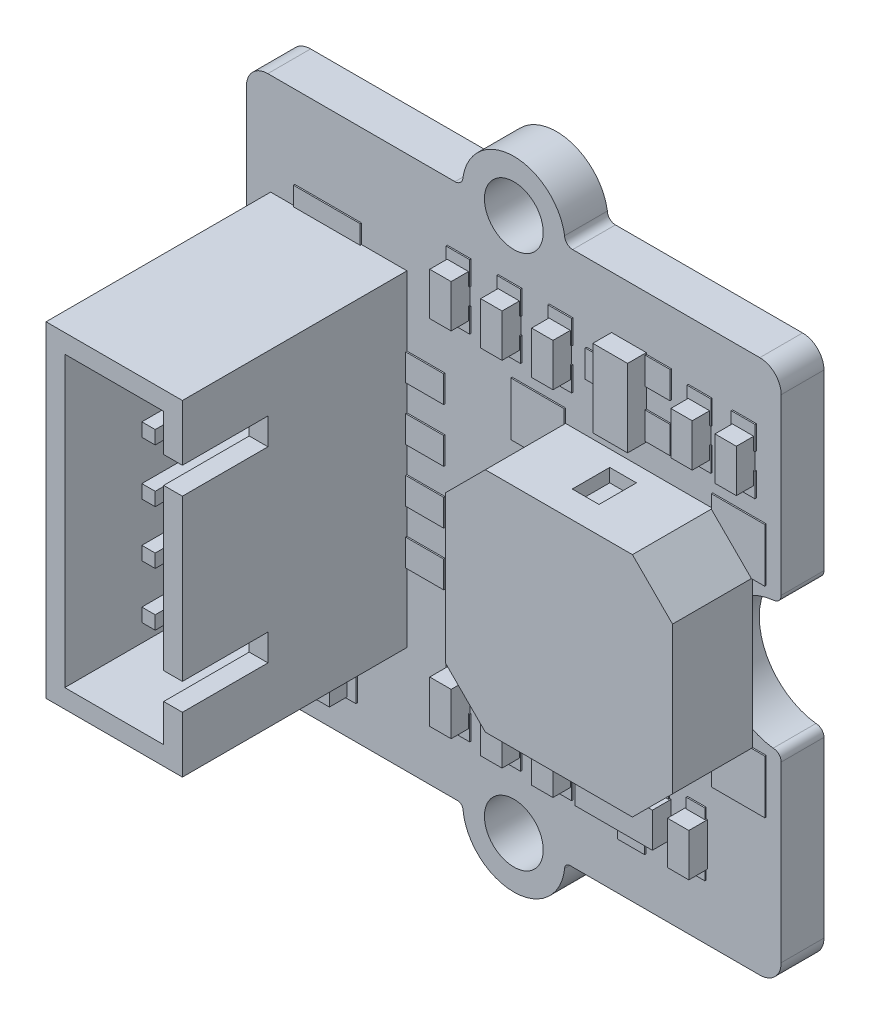
from build123d import *

# Parameters (mm, degrees)
ESQUISSE1_R                            = 1.1
PCB_CONTOUR_EAGLE_EP_ESTIMEE_1_6_DEPTH = 1.6
GROVE_POSITION_EAGLE_H_ESTIMEE_START   = 1.6
ESQUISSE2_W                            = 5.1
ESQUISSE2_H                            = 12.2
GROVE_POSITION_EAGLE_H_ESTIMEE_DEPTH   = 8.4
CAVITE_CONNECTEUR_START                = 10
ESQUISSE3_W                            = 3.7
ESQUISSE3_H                            = 10.8
CAVITE_CONNECTEUR_DEPTH                = 7.3
DETROMPEURS_ESTIMES_START              = 10
ESQUISSE4_W                            = 1
ESQUISSE4_H                            = 1
DETROMPEURS_ESTIMES_DEPTH              = 3.2
CONTACTS_GROVE_PAS_2MM_START           = 2.7
ESQUISSE5_W                            = 0.5
ESQUISSE5_H                            = 0.5
CONTACTS_GROVE_PAS_2MM_DEPTH           = 5.9
CONTACTS_GROVE_PAS_2MM_2_DEPTH         = 5.9
CONTACTS_GROVE_PAS_2MM_3_DEPTH         = 5.9
CONTACTS_GROVE_PAS_2MM_4_DEPTH         = 5.9
MLT8530_8_5X8_5X3_START                = 1.6
MLT8530_8_5X8_5X3_DEPTH                = 3
SORTIE_SON_LATERALE_ESTIMEE_START      = 3.6
ESQUISSE7_W                            = 1
ESQUISSE7_H                            = 0.8
SORTIE_SON_LATERALE_ESTIMEE_DEPTH      = 1.4
C1_POSITION_EAGLE_H_SIMPLIFIEE_START   = 1.6
ESQUISSE8_W                            = 0.8
ESQUISSE8_H                            = 1.6
C1_POSITION_EAGLE_H_SIMPLIFIEE_DEPTH   = 0.7
C2_POSITION_EAGLE_H_SIMPLIFIEE_START   = 1.6
ESQUISSE9_W                            = 0.8
ESQUISSE9_H                            = 1.6
C2_POSITION_EAGLE_H_SIMPLIFIEE_DEPTH   = 0.7
Q1_POSITION_EAGLE_H_SIMPLIFIEE_START   = 1.6
ESQUISSE10_W                           = 2.9
ESQUISSE10_H                           = 1.3
Q1_POSITION_EAGLE_H_SIMPLIFIEE_DEPTH   = 0.7
R1_POSITION_EAGLE_H_SIMPLIFIEE_START   = 1.6
ESQUISSE11_W                           = 0.8
ESQUISSE11_H                           = 1.6
R1_POSITION_EAGLE_H_SIMPLIFIEE_DEPTH   = 0.7
U1_POSITION_EAGLE_H_SIMPLIFIEE_START   = 1.6
ESQUISSE12_W                           = 1.3
ESQUISSE12_H                           = 2.9
U1_POSITION_EAGLE_H_SIMPLIFIEE_DEPTH   = 0.7
C3_POSITION_EAGLE_H_SIMPLIFIEE_START   = 1.6
ESQUISSE13_W                           = 0.8
ESQUISSE13_H                           = 1.6
C3_POSITION_EAGLE_H_SIMPLIFIEE_DEPTH   = 0.7
C5_POSITION_EAGLE_H_SIMPLIFIEE_START   = 1.6
ESQUISSE14_W                           = 0.8
ESQUISSE14_H                           = 1.6
C5_POSITION_EAGLE_H_SIMPLIFIEE_DEPTH   = 0.7
C4_POSITION_EAGLE_H_SIMPLIFIEE_START   = 1.6
ESQUISSE15_W                           = 0.8
ESQUISSE15_H                           = 1.6
C4_POSITION_EAGLE_H_SIMPLIFIEE_DEPTH   = 0.7
R2_POSITION_EAGLE_H_SIMPLIFIEE_START   = 1.6
ESQUISSE16_W                           = 0.8
ESQUISSE16_H                           = 1.6
R2_POSITION_EAGLE_H_SIMPLIFIEE_DEPTH   = 0.7
D1_POSITION_EAGLE_H_SIMPLIFIEE_START   = 1.6
ESQUISSE17_W                           = 1.6
ESQUISSE17_H                           = 0.8
D1_POSITION_EAGLE_H_SIMPLIFIEE_DEPTH   = 0.7
D2_POSITION_EAGLE_H_SIMPLIFIEE_START   = 1.6
ESQUISSE18_W                           = 0.8
ESQUISSE18_H                           = 1.6
D2_POSITION_EAGLE_H_SIMPLIFIEE_DEPTH   = 0.7
R3_POSITION_EAGLE_H_SIMPLIFIEE_START   = 1.6
ESQUISSE19_W                           = 0.8
ESQUISSE19_H                           = 1.6
R3_POSITION_EAGLE_H_SIMPLIFIEE_DEPTH   = 0.7
PAD_C1_0_START                         = 1.6
ESQUISSE20_W                           = 0.889
ESQUISSE20_H                           = 0.889
PAD_C1_0_DEPTH                         = 0.05
PAD_C1_1_START                         = 1.6
ESQUISSE21_W                           = 0.889
ESQUISSE21_H                           = 0.889
PAD_C1_1_DEPTH                         = 0.05
PAD_C2_0_START                         = 1.6
ESQUISSE22_W                           = 0.889
ESQUISSE22_H                           = 0.889
PAD_C2_0_DEPTH                         = 0.05
PAD_C2_1_START                         = 1.6
ESQUISSE23_W                           = 0.889
ESQUISSE23_H                           = 0.889
PAD_C2_1_DEPTH                         = 0.05
PAD_J1_0_START                         = 1.6
ESQUISSE24_W                           = 2.5
ESQUISSE24_H                           = 1
PAD_J1_0_DEPTH                         = 0.05
PAD_J1_1_START                         = 1.6
ESQUISSE25_W                           = 2.5
ESQUISSE25_H                           = 1
PAD_J1_1_DEPTH                         = 0.05
PAD_J1_2_START                         = 1.6
ESQUISSE26_W                           = 2.5
ESQUISSE26_H                           = 1
PAD_J1_2_DEPTH                         = 0.05
PAD_J1_3_START                         = 1.6
ESQUISSE27_W                           = 2.5
ESQUISSE27_H                           = 1
PAD_J1_3_DEPTH                         = 0.05
PAD_J1_4_START                         = 1.6
ESQUISSE28_W                           = 2.5
ESQUISSE28_H                           = 2
PAD_J1_4_DEPTH                         = 0.05
PAD_J1_5_START                         = 1.6
ESQUISSE29_W                           = 2.5
ESQUISSE29_H                           = 2
PAD_J1_5_DEPTH                         = 0.05
PAD_Q1_0_START                         = 1.6
ESQUISSE30_W                           = 1.016
ESQUISSE30_H                           = 1.143
PAD_Q1_0_DEPTH                         = 0.05
PAD_Q1_1_START                         = 1.6
ESQUISSE31_W                           = 1.016
ESQUISSE31_H                           = 1.143
PAD_Q1_1_DEPTH                         = 0.05
PAD_Q1_2_START                         = 1.6
ESQUISSE32_W                           = 1.016
ESQUISSE32_H                           = 1.143
PAD_Q1_2_DEPTH                         = 0.05
PAD_R1_0_START                         = 1.6
ESQUISSE33_W                           = 0.889
ESQUISSE33_H                           = 0.889
PAD_R1_0_DEPTH                         = 0.05
PAD_R1_1_START                         = 1.6
ESQUISSE34_W                           = 0.889
ESQUISSE34_H                           = 0.889
PAD_R1_1_DEPTH                         = 0.05
PAD_BUZ1_0_START                       = 1.6
ESQUISSE35_W                           = 2
ESQUISSE35_H                           = 2
PAD_BUZ1_0_DEPTH                       = 0.05
PAD_BUZ1_1_START                       = 1.6
ESQUISSE36_W                           = 2
ESQUISSE36_H                           = 2
PAD_BUZ1_1_DEPTH                       = 0.05
PAD_BUZ1_2_START                       = 1.6
ESQUISSE37_W                           = 2
ESQUISSE37_H                           = 2
PAD_BUZ1_2_DEPTH                       = 0.05
PAD_BUZ1_3_START                       = 1.6
ESQUISSE38_W                           = 2
ESQUISSE38_H                           = 2
PAD_BUZ1_3_DEPTH                       = 0.05
PAD_U1_0_START                         = 1.6
ESQUISSE39_W                           = 1.143
ESQUISSE39_H                           = 1.016
PAD_U1_0_DEPTH                         = 0.05
PAD_U1_1_START                         = 1.6
ESQUISSE40_W                           = 1.143
ESQUISSE40_H                           = 1.016
PAD_U1_1_DEPTH                         = 0.05
PAD_U1_2_START                         = 1.6
ESQUISSE41_W                           = 1.143
ESQUISSE41_H                           = 1.016
PAD_U1_2_DEPTH                         = 0.05
PAD_C3_0_START                         = 1.6
ESQUISSE42_W                           = 0.889
ESQUISSE42_H                           = 0.889
PAD_C3_0_DEPTH                         = 0.05
PAD_C3_1_START                         = 1.6
ESQUISSE43_W                           = 0.889
ESQUISSE43_H                           = 0.889
PAD_C3_1_DEPTH                         = 0.05
PAD_C5_0_START                         = 1.6
ESQUISSE44_W                           = 0.889
ESQUISSE44_H                           = 0.889
PAD_C5_0_DEPTH                         = 0.05
PAD_C5_1_START                         = 1.6
ESQUISSE45_W                           = 0.889
ESQUISSE45_H                           = 0.889
PAD_C5_1_DEPTH                         = 0.05
PAD_C4_0_START                         = 1.6
ESQUISSE46_W                           = 0.889
ESQUISSE46_H                           = 0.889
PAD_C4_0_DEPTH                         = 0.05
PAD_C4_1_START                         = 1.6
ESQUISSE47_W                           = 0.889
ESQUISSE47_H                           = 0.889
PAD_C4_1_DEPTH                         = 0.05
PAD_R2_0_START                         = 1.6
ESQUISSE48_W                           = 0.889
ESQUISSE48_H                           = 0.889
PAD_R2_0_DEPTH                         = 0.05
PAD_R2_1_START                         = 1.6
ESQUISSE49_W                           = 0.889
ESQUISSE49_H                           = 0.889
PAD_R2_1_DEPTH                         = 0.05
PAD_D1_0_START                         = 1.6
ESQUISSE50_W                           = 0.762
ESQUISSE50_H                           = 0.889
PAD_D1_0_DEPTH                         = 0.05
PAD_D1_1_START                         = 1.6
ESQUISSE51_W                           = 0.762
ESQUISSE51_H                           = 0.889
PAD_D1_1_DEPTH                         = 0.05
PAD_D2_0_START                         = 1.6
ESQUISSE52_W                           = 0.7
ESQUISSE52_H                           = 0.762
PAD_D2_0_DEPTH                         = 0.05
PAD_D2_1_START                         = 1.6
ESQUISSE53_W                           = 0.7
ESQUISSE53_H                           = 0.762
PAD_D2_1_DEPTH                         = 0.05
PAD_R3_0_START                         = 1.6
ESQUISSE54_W                           = 0.889
ESQUISSE54_H                           = 0.889
PAD_R3_0_DEPTH                         = 0.05
PAD_R3_1_START                         = 1.6
ESQUISSE55_W                           = 0.889
ESQUISSE55_H                           = 0.889
PAD_R3_1_DEPTH                         = 0.05


with BuildPart() as part:
    # Esquisse1 → PCB_contour_Eagle_ep_ESTIMEE_1_6 (new body)
    with BuildSketch(Plane.XY):
        with BuildLine():
            Line((-9.1873, -9.9873), (-2.0873, -9.9873))
            ThreePointArc((-2.0873, -9.9873), (-1.945878644, -10.045878644), (-1.8873, -10.1873))
            ThreePointArc((-1.8873, -10.1873), (0.0127, -11.897797316), (1.9127, -10.1873))
            ThreePointArc((1.9127, -10.1873), (1.971278644, -10.045878644), (2.1127, -9.9873))
            Line((2.1127, -9.9873), (9.2127, -9.9873))
            ThreePointArc((9.2127, -9.9873), (9.778385425, -9.752985425), (10.0127, -9.1873))
            Line((10.0127, -9.1873), (10.0127, -2.6873))
            ThreePointArc((10.0127, -2.6873), (9.924832034, -2.475167966), (9.7127, -2.3873))
            ThreePointArc((9.7127, -2.3873), (7.594022681, 0.0127), (9.7127, 2.4127))
            ThreePointArc((9.7127, 2.4127), (9.924832034, 2.500567966), (10.0127, 2.7127))
            Line((10.0127, 2.7127), (10.0127, 9.2127))
            ThreePointArc((10.0127, 9.2127), (9.778385425, 9.778385425), (9.2127, 10.0127))
            Line((9.2127, 10.0127), (2.2127, 10.0127))
            ThreePointArc((2.2127, 10.0127), (2.000567966, 10.100567966), (1.9127, 10.3127))
            ThreePointArc((1.9127, 10.3127), (0.0127, 11.936238409), (-1.8873, 10.3127))
            ThreePointArc((-1.8873, 10.3127), (-1.975167966, 10.100567966), (-2.1873, 10.0127))
            Line((-2.1873, 10.0127), (-9.1873, 10.0127))
            ThreePointArc((-9.1873, 10.0127), (-9.752985425, 9.778385425), (-9.9873, 9.2127))
            Line((-9.9873, 9.2127), (-9.9873, 2.7127))
            ThreePointArc((-9.9873, 2.7127), (-9.899432034, 2.500567966), (-9.6873, 2.4127))
            ThreePointArc((-9.6873, 2.4127), (-7.568622681, 0.0127), (-9.6873, -2.3873))
            ThreePointArc((-9.6873, -2.3873), (-9.899432034, -2.475167966), (-9.9873, -2.6873))
            Line((-9.9873, -2.6873), (-9.9873, -9.1873))
            ThreePointArc((-9.9873, -9.1873), (-9.752985425, -9.752985425), (-9.1873, -9.9873))
        make_face()
        with Locations((0.0127, -9.987299999)):
            Circle(ESQUISSE1_R, mode=Mode.SUBTRACT)
        with Locations((0.0127, 10.012700004)):
            Circle(ESQUISSE1_R, mode=Mode.SUBTRACT)
    extrude(amount=PCB_CONTOUR_EAGLE_EP_ESTIMEE_1_6_DEPTH)


with BuildPart() as body_2:
    # Esquisse2 → Grove_position_Eagle_H_ESTIMEE (new body)
    with BuildSketch(Plane.XY.offset(GROVE_POSITION_EAGLE_H_ESTIMEE_START)):
        with Locations((-6.533, 0.127)):
            Rectangle(ESQUISSE2_W, ESQUISSE2_H)
    extrude(amount=GROVE_POSITION_EAGLE_H_ESTIMEE_DEPTH)

    # Esquisse3 → Cavite_connecteur (cut)
    with BuildSketch(Plane.XY.offset(CAVITE_CONNECTEUR_START)):
        with Locations((-6.533, 0.127)):
            Rectangle(ESQUISSE3_W, ESQUISSE3_H)
    extrude(amount=-CAVITE_CONNECTEUR_DEPTH, mode=Mode.SUBTRACT)

    # Esquisse4 → Detrompeurs_ESTIMES (cut)
    with BuildSketch(Plane.XY.offset(DETROMPEURS_ESTIMES_START)):
        with Locations((-4.283, -3.373)):
            Rectangle(ESQUISSE4_W, ESQUISSE4_H)
        with Locations((-4.283, 3.627)):
            Rectangle(ESQUISSE4_W, ESQUISSE4_H)
    extrude(amount=-DETROMPEURS_ESTIMES_DEPTH, mode=Mode.SUBTRACT)


with BuildPart() as body_3:
    # Esquisse5 → Contacts_Grove_pas_2mm (new body)
    with BuildSketch(Plane.XY.offset(CONTACTS_GROVE_PAS_2MM_START)):
        with Locations((-6.65, -2.873)):
            Rectangle(ESQUISSE5_W, ESQUISSE5_H)
    extrude(amount=CONTACTS_GROVE_PAS_2MM_DEPTH)


with BuildPart() as body_4:
    # Esquisse5 → Contacts_Grove_pas_2mm 2 (new body)
    with BuildSketch(Plane.XY.offset(CONTACTS_GROVE_PAS_2MM_START)):
        with Locations((-6.65, -0.873)):
            Rectangle(ESQUISSE5_W, ESQUISSE5_H)
    extrude(amount=CONTACTS_GROVE_PAS_2MM_2_DEPTH)


with BuildPart() as body_5:
    # Esquisse5 → Contacts_Grove_pas_2mm 3 (new body)
    with BuildSketch(Plane.XY.offset(CONTACTS_GROVE_PAS_2MM_START)):
        with Locations((-6.65, 1.127)):
            Rectangle(ESQUISSE5_W, ESQUISSE5_H)
    extrude(amount=CONTACTS_GROVE_PAS_2MM_3_DEPTH)


with BuildPart() as body_6:
    # Esquisse5 → Contacts_Grove_pas_2mm 4 (new body)
    with BuildSketch(Plane.XY.offset(CONTACTS_GROVE_PAS_2MM_START)):
        with Locations((-6.65, 3.127)):
            Rectangle(ESQUISSE5_W, ESQUISSE5_H)
    extrude(amount=CONTACTS_GROVE_PAS_2MM_4_DEPTH)


with BuildPart() as body_7:
    # Esquisse6 → MLT8530_8_5x8_5x3 (new body)
    with BuildSketch(Plane.XY.offset(MLT8530_8_5X8_5X3_START)):
        Polygon((1.949, -4.25), (7.449, -4.25), (8.949, -2.75), (8.949, 2.75), (7.449, 4.25), (1.949, 4.25), (0.449, 2.75), (0.449, -2.75), align=None)
    extrude(amount=MLT8530_8_5X8_5X3_DEPTH)

    # Esquisse7 → Sortie_son_laterale_ESTIMEE (cut)
    with BuildSketch(Plane.XY.offset(SORTIE_SON_LATERALE_ESTIMEE_START)):
        with Locations((4.699, 4.15)):
            Rectangle(ESQUISSE7_W, ESQUISSE7_H)
    extrude(amount=-SORTIE_SON_LATERALE_ESTIMEE_DEPTH, mode=Mode.SUBTRACT)


with BuildPart() as body_8:
    # Esquisse8 → C1_position_Eagle_H_simplifiee (new body)
    with BuildSketch(Plane.XY.offset(C1_POSITION_EAGLE_H_SIMPLIFIEE_START)):
        with Locations((-0.127, 6.604)):
            Rectangle(ESQUISSE8_W, ESQUISSE8_H)
    extrude(amount=C1_POSITION_EAGLE_H_SIMPLIFIEE_DEPTH)


with BuildPart() as body_9:
    # Esquisse9 → C2_position_Eagle_H_simplifiee (new body)
    with BuildSketch(Plane.XY.offset(C2_POSITION_EAGLE_H_SIMPLIFIEE_START)):
        with Locations((-2.032, 6.604)):
            Rectangle(ESQUISSE9_W, ESQUISSE9_H)
    extrude(amount=C2_POSITION_EAGLE_H_SIMPLIFIEE_DEPTH)


with BuildPart() as body_10:
    # Esquisse10 → Q1_position_Eagle_H_simplifiee (new body)
    with BuildSketch(Plane.XY.offset(Q1_POSITION_EAGLE_H_SIMPLIFIEE_START)):
        with Locations((4.445, -6.604)):
            Rectangle(ESQUISSE10_W, ESQUISSE10_H)
    extrude(amount=Q1_POSITION_EAGLE_H_SIMPLIFIEE_DEPTH)


with BuildPart() as body_11:
    # Esquisse11 → R1_position_Eagle_H_simplifiee (new body)
    with BuildSketch(Plane.XY.offset(R1_POSITION_EAGLE_H_SIMPLIFIEE_START)):
        with Locations((-0.127, -6.604)):
            Rectangle(ESQUISSE11_W, ESQUISSE11_H)
    extrude(amount=R1_POSITION_EAGLE_H_SIMPLIFIEE_DEPTH)


with BuildPart() as body_12:
    # Esquisse12 → U1_position_Eagle_H_simplifiee (new body)
    with BuildSketch(Plane.XY.offset(U1_POSITION_EAGLE_H_SIMPLIFIEE_START)):
        with Locations((4.318, 6.604)):
            Rectangle(ESQUISSE12_W, ESQUISSE12_H)
    extrude(amount=U1_POSITION_EAGLE_H_SIMPLIFIEE_DEPTH)


with BuildPart() as body_13:
    # Esquisse13 → C3_position_Eagle_H_simplifiee (new body)
    with BuildSketch(Plane.XY.offset(C3_POSITION_EAGLE_H_SIMPLIFIEE_START)):
        with Locations((1.778, 6.604)):
            Rectangle(ESQUISSE13_W, ESQUISSE13_H)
    extrude(amount=C3_POSITION_EAGLE_H_SIMPLIFIEE_DEPTH)


with BuildPart() as body_14:
    # Esquisse14 → C5_position_Eagle_H_simplifiee (new body)
    with BuildSketch(Plane.XY.offset(C5_POSITION_EAGLE_H_SIMPLIFIEE_START)):
        with Locations((8.636, 6.604)):
            Rectangle(ESQUISSE14_W, ESQUISSE14_H)
    extrude(amount=C5_POSITION_EAGLE_H_SIMPLIFIEE_DEPTH)


with BuildPart() as body_15:
    # Esquisse15 → C4_position_Eagle_H_simplifiee (new body)
    with BuildSketch(Plane.XY.offset(C4_POSITION_EAGLE_H_SIMPLIFIEE_START)):
        with Locations((6.985, 6.604)):
            Rectangle(ESQUISSE15_W, ESQUISSE15_H)
    extrude(amount=C4_POSITION_EAGLE_H_SIMPLIFIEE_DEPTH)


with BuildPart() as body_16:
    # Esquisse16 → R2_position_Eagle_H_simplifiee (new body)
    with BuildSketch(Plane.XY.offset(R2_POSITION_EAGLE_H_SIMPLIFIEE_START)):
        with Locations((-2.032, -6.604)):
            Rectangle(ESQUISSE16_W, ESQUISSE16_H)
    extrude(amount=R2_POSITION_EAGLE_H_SIMPLIFIEE_DEPTH)


with BuildPart() as body_17:
    # Esquisse17 → D1_position_Eagle_H_simplifiee (new body)
    with BuildSketch(Plane.XY.offset(D1_POSITION_EAGLE_H_SIMPLIFIEE_START)):
        with Locations((-6.985, -8.255)):
            Rectangle(ESQUISSE17_W, ESQUISSE17_H)
    extrude(amount=D1_POSITION_EAGLE_H_SIMPLIFIEE_DEPTH)


with BuildPart() as body_18:
    # Esquisse18 → D2_position_Eagle_H_simplifiee (new body)
    with BuildSketch(Plane.XY.offset(D2_POSITION_EAGLE_H_SIMPLIFIEE_START)):
        with Locations((6.858, -6.731)):
            Rectangle(ESQUISSE18_W, ESQUISSE18_H)
    extrude(amount=D2_POSITION_EAGLE_H_SIMPLIFIEE_DEPTH)


with BuildPart() as body_19:
    # Esquisse19 → R3_position_Eagle_H_simplifiee (new body)
    with BuildSketch(Plane.XY.offset(R3_POSITION_EAGLE_H_SIMPLIFIEE_START)):
        with Locations((1.778, -6.604)):
            Rectangle(ESQUISSE19_W, ESQUISSE19_H)
    extrude(amount=R3_POSITION_EAGLE_H_SIMPLIFIEE_DEPTH)


with BuildPart() as body_20:
    # Esquisse20 → Pad_C1_0 (new body)
    with BuildSketch(Plane.XY.offset(PAD_C1_0_START)):
        with Locations((-0.127, 7.366)):
            Rectangle(ESQUISSE20_W, ESQUISSE20_H)
    extrude(amount=PAD_C1_0_DEPTH)


with BuildPart() as body_21:
    # Esquisse21 → Pad_C1_1 (new body)
    with BuildSketch(Plane.XY.offset(PAD_C1_1_START)):
        with Locations((-0.127, 5.842)):
            Rectangle(ESQUISSE21_W, ESQUISSE21_H)
    extrude(amount=PAD_C1_1_DEPTH)


with BuildPart() as body_22:
    # Esquisse22 → Pad_C2_0 (new body)
    with BuildSketch(Plane.XY.offset(PAD_C2_0_START)):
        with Locations((-2.032, 7.366)):
            Rectangle(ESQUISSE22_W, ESQUISSE22_H)
    extrude(amount=PAD_C2_0_DEPTH)


with BuildPart() as body_23:
    # Esquisse23 → Pad_C2_1 (new body)
    with BuildSketch(Plane.XY.offset(PAD_C2_1_START)):
        with Locations((-2.032, 5.842)):
            Rectangle(ESQUISSE23_W, ESQUISSE23_H)
    extrude(amount=PAD_C2_1_DEPTH)


with BuildPart() as body_24:
    # Esquisse24 → Pad_J1_0 (new body)
    with BuildSketch(Plane.XY.offset(PAD_J1_0_START)):
        with Locations((-3.81, -2.873)):
            Rectangle(ESQUISSE24_W, ESQUISSE24_H)
    extrude(amount=PAD_J1_0_DEPTH)


with BuildPart() as body_25:
    # Esquisse25 → Pad_J1_1 (new body)
    with BuildSketch(Plane.XY.offset(PAD_J1_1_START)):
        with Locations((-3.81, -0.873)):
            Rectangle(ESQUISSE25_W, ESQUISSE25_H)
    extrude(amount=PAD_J1_1_DEPTH)


with BuildPart() as body_26:
    # Esquisse26 → Pad_J1_2 (new body)
    with BuildSketch(Plane.XY.offset(PAD_J1_2_START)):
        with Locations((-3.81, 1.127)):
            Rectangle(ESQUISSE26_W, ESQUISSE26_H)
    extrude(amount=PAD_J1_2_DEPTH)


with BuildPart() as body_27:
    # Esquisse27 → Pad_J1_3 (new body)
    with BuildSketch(Plane.XY.offset(PAD_J1_3_START)):
        with Locations((-3.81, 3.127)):
            Rectangle(ESQUISSE27_W, ESQUISSE27_H)
    extrude(amount=PAD_J1_3_DEPTH)


with BuildPart() as body_28:
    # Esquisse28 → Pad_J1_4 (new body)
    with BuildSketch(Plane.XY.offset(PAD_J1_4_START)):
        with Locations((-6.933, -5.673)):
            Rectangle(ESQUISSE28_W, ESQUISSE28_H)
    extrude(amount=PAD_J1_4_DEPTH)


with BuildPart() as body_29:
    # Esquisse29 → Pad_J1_5 (new body)
    with BuildSketch(Plane.XY.offset(PAD_J1_5_START)):
        with Locations((-6.933, 5.927)):
            Rectangle(ESQUISSE29_W, ESQUISSE29_H)
    extrude(amount=PAD_J1_5_DEPTH)


with BuildPart() as body_30:
    # Esquisse30 → Pad_Q1_0 (new body)
    with BuildSketch(Plane.XY.offset(PAD_Q1_0_START)):
        with Locations((4.445, -7.62)):
            Rectangle(ESQUISSE30_W, ESQUISSE30_H)
    extrude(amount=PAD_Q1_0_DEPTH)


with BuildPart() as body_31:
    # Esquisse31 → Pad_Q1_1 (new body)
    with BuildSketch(Plane.XY.offset(PAD_Q1_1_START)):
        with Locations((3.556, -5.588)):
            Rectangle(ESQUISSE31_W, ESQUISSE31_H)
    extrude(amount=PAD_Q1_1_DEPTH)


with BuildPart() as body_32:
    # Esquisse32 → Pad_Q1_2 (new body)
    with BuildSketch(Plane.XY.offset(PAD_Q1_2_START)):
        with Locations((5.334, -5.588)):
            Rectangle(ESQUISSE32_W, ESQUISSE32_H)
    extrude(amount=PAD_Q1_2_DEPTH)


with BuildPart() as body_33:
    # Esquisse33 → Pad_R1_0 (new body)
    with BuildSketch(Plane.XY.offset(PAD_R1_0_START)):
        with Locations((-0.127, -7.366)):
            Rectangle(ESQUISSE33_W, ESQUISSE33_H)
    extrude(amount=PAD_R1_0_DEPTH)


with BuildPart() as body_34:
    # Esquisse34 → Pad_R1_1 (new body)
    with BuildSketch(Plane.XY.offset(PAD_R1_1_START)):
        with Locations((-0.127, -5.842)):
            Rectangle(ESQUISSE34_W, ESQUISSE34_H)
    extrude(amount=PAD_R1_1_DEPTH)


with BuildPart() as body_35:
    # Esquisse35 → Pad_BUZ1_0 (new body)
    with BuildSketch(Plane.XY.offset(PAD_BUZ1_0_START)):
        with Locations((0.949, -3.75)):
            Rectangle(ESQUISSE35_W, ESQUISSE35_H)
    extrude(amount=PAD_BUZ1_0_DEPTH)


with BuildPart() as body_36:
    # Esquisse36 → Pad_BUZ1_1 (new body)
    with BuildSketch(Plane.XY.offset(PAD_BUZ1_1_START)):
        with Locations((8.449, -3.75)):
            Rectangle(ESQUISSE36_W, ESQUISSE36_H)
    extrude(amount=PAD_BUZ1_1_DEPTH)


with BuildPart() as body_37:
    # Esquisse37 → Pad_BUZ1_2 (new body)
    with BuildSketch(Plane.XY.offset(PAD_BUZ1_2_START)):
        with Locations((8.449, 3.75)):
            Rectangle(ESQUISSE37_W, ESQUISSE37_H)
    extrude(amount=PAD_BUZ1_2_DEPTH)


with BuildPart() as body_38:
    # Esquisse38 → Pad_BUZ1_3 (new body)
    with BuildSketch(Plane.XY.offset(PAD_BUZ1_3_START)):
        with Locations((0.949, 3.75)):
            Rectangle(ESQUISSE38_W, ESQUISSE38_H)
    extrude(amount=PAD_BUZ1_3_DEPTH)


with BuildPart() as body_39:
    # Esquisse39 → Pad_U1_0 (new body)
    with BuildSketch(Plane.XY.offset(PAD_U1_0_START)):
        with Locations((3.302, 6.604)):
            Rectangle(ESQUISSE39_W, ESQUISSE39_H)
    extrude(amount=PAD_U1_0_DEPTH)


with BuildPart() as body_40:
    # Esquisse40 → Pad_U1_1 (new body)
    with BuildSketch(Plane.XY.offset(PAD_U1_1_START)):
        with Locations((5.334, 7.493)):
            Rectangle(ESQUISSE40_W, ESQUISSE40_H)
    extrude(amount=PAD_U1_1_DEPTH)


with BuildPart() as body_41:
    # Esquisse41 → Pad_U1_2 (new body)
    with BuildSketch(Plane.XY.offset(PAD_U1_2_START)):
        with Locations((5.334, 5.715)):
            Rectangle(ESQUISSE41_W, ESQUISSE41_H)
    extrude(amount=PAD_U1_2_DEPTH)


with BuildPart() as body_42:
    # Esquisse42 → Pad_C3_0 (new body)
    with BuildSketch(Plane.XY.offset(PAD_C3_0_START)):
        with Locations((1.778, 7.366)):
            Rectangle(ESQUISSE42_W, ESQUISSE42_H)
    extrude(amount=PAD_C3_0_DEPTH)


with BuildPart() as body_43:
    # Esquisse43 → Pad_C3_1 (new body)
    with BuildSketch(Plane.XY.offset(PAD_C3_1_START)):
        with Locations((1.778, 5.842)):
            Rectangle(ESQUISSE43_W, ESQUISSE43_H)
    extrude(amount=PAD_C3_1_DEPTH)


with BuildPart() as body_44:
    # Esquisse44 → Pad_C5_0 (new body)
    with BuildSketch(Plane.XY.offset(PAD_C5_0_START)):
        with Locations((8.636, 5.842)):
            Rectangle(ESQUISSE44_W, ESQUISSE44_H)
    extrude(amount=PAD_C5_0_DEPTH)


with BuildPart() as body_45:
    # Esquisse45 → Pad_C5_1 (new body)
    with BuildSketch(Plane.XY.offset(PAD_C5_1_START)):
        with Locations((8.636, 7.366)):
            Rectangle(ESQUISSE45_W, ESQUISSE45_H)
    extrude(amount=PAD_C5_1_DEPTH)


with BuildPart() as body_46:
    # Esquisse46 → Pad_C4_0 (new body)
    with BuildSketch(Plane.XY.offset(PAD_C4_0_START)):
        with Locations((6.985, 5.842)):
            Rectangle(ESQUISSE46_W, ESQUISSE46_H)
    extrude(amount=PAD_C4_0_DEPTH)


with BuildPart() as body_47:
    # Esquisse47 → Pad_C4_1 (new body)
    with BuildSketch(Plane.XY.offset(PAD_C4_1_START)):
        with Locations((6.985, 7.366)):
            Rectangle(ESQUISSE47_W, ESQUISSE47_H)
    extrude(amount=PAD_C4_1_DEPTH)


with BuildPart() as body_48:
    # Esquisse48 → Pad_R2_0 (new body)
    with BuildSketch(Plane.XY.offset(PAD_R2_0_START)):
        with Locations((-2.032, -7.366)):
            Rectangle(ESQUISSE48_W, ESQUISSE48_H)
    extrude(amount=PAD_R2_0_DEPTH)


with BuildPart() as body_49:
    # Esquisse49 → Pad_R2_1 (new body)
    with BuildSketch(Plane.XY.offset(PAD_R2_1_START)):
        with Locations((-2.032, -5.842)):
            Rectangle(ESQUISSE49_W, ESQUISSE49_H)
    extrude(amount=PAD_R2_1_DEPTH)


with BuildPart() as body_50:
    # Esquisse50 → Pad_D1_0 (new body)
    with BuildSketch(Plane.XY.offset(PAD_D1_0_START)):
        with Locations((-6.223, -8.255)):
            Rectangle(ESQUISSE50_W, ESQUISSE50_H)
    extrude(amount=PAD_D1_0_DEPTH)


with BuildPart() as body_51:
    # Esquisse51 → Pad_D1_1 (new body)
    with BuildSketch(Plane.XY.offset(PAD_D1_1_START)):
        with Locations((-7.747, -8.255)):
            Rectangle(ESQUISSE51_W, ESQUISSE51_H)
    extrude(amount=PAD_D1_1_DEPTH)


with BuildPart() as body_52:
    # Esquisse52 → Pad_D2_0 (new body)
    with BuildSketch(Plane.XY.offset(PAD_D2_0_START)):
        with Locations((6.858, -7.531)):
            Rectangle(ESQUISSE52_W, ESQUISSE52_H)
    extrude(amount=PAD_D2_0_DEPTH)


with BuildPart() as body_53:
    # Esquisse53 → Pad_D2_1 (new body)
    with BuildSketch(Plane.XY.offset(PAD_D2_1_START)):
        with Locations((6.858, -5.931)):
            Rectangle(ESQUISSE53_W, ESQUISSE53_H)
    extrude(amount=PAD_D2_1_DEPTH)


with BuildPart() as body_54:
    # Esquisse54 → Pad_R3_0 (new body)
    with BuildSketch(Plane.XY.offset(PAD_R3_0_START)):
        with Locations((1.778, -7.366)):
            Rectangle(ESQUISSE54_W, ESQUISSE54_H)
    extrude(amount=PAD_R3_0_DEPTH)


with BuildPart() as body_55:
    # Esquisse55 → Pad_R3_1 (new body)
    with BuildSketch(Plane.XY.offset(PAD_R3_1_START)):
        with Locations((1.778, -5.842)):
            Rectangle(ESQUISSE55_W, ESQUISSE55_H)
    extrude(amount=PAD_R3_1_DEPTH)


solid = Compound([part.part, body_2.part, body_3.part, body_4.part, body_5.part, body_6.part, body_7.part, body_8.part, body_9.part, body_10.part, body_11.part, body_12.part, body_13.part, body_14.part, body_15.part, body_16.part, body_17.part, body_18.part, body_19.part, body_20.part, body_21.part, body_22.part, body_23.part, body_24.part, body_25.part, body_26.part, body_27.part, body_28.part, body_29.part, body_30.part, body_31.part, body_32.part, body_33.part, body_34.part, body_35.part, body_36.part, body_37.part, body_38.part, body_39.part, body_40.part, body_41.part, body_42.part, body_43.part, body_44.part, body_45.part, body_46.part, body_47.part, body_48.part, body_49.part, body_50.part, body_51.part, body_52.part, body_53.part, body_54.part, body_55.part])
